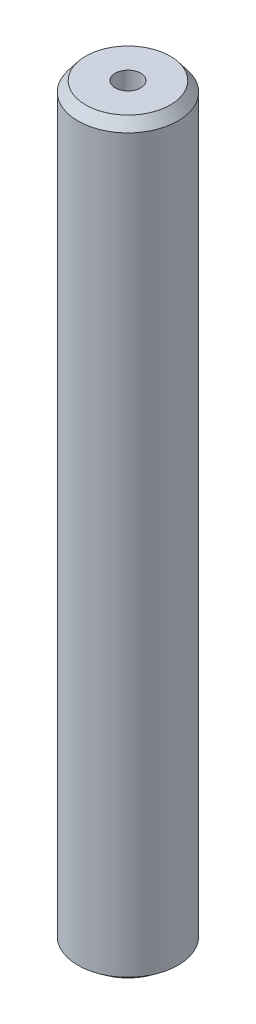
from build123d import *
from OCP.BRepFilletAPI import BRepFilletAPI_MakeChamfer

# Parameters (mm, degrees)
SKETCH1_R           = 5
BOSS_EXTRUDE1_DEPTH = 74.839464028
SKETCH2_R           = 1.274872446
CUT_EXTRUDE1_DEPTH  = 76.172770176
CHAMFER1_SIZE       = 0.999535333
CHAMFER1_SIZE2      = 0.771965313


with BuildPart() as part:
    # Sketch1 → Boss-Extrude1 (new body)
    with BuildSketch(Plane(origin=(0, 0, 0), x_dir=(1, 0, 0), z_dir=(0, 1, 0))):
        Circle(SKETCH1_R)
    extrude(amount=BOSS_EXTRUDE1_DEPTH)

    # Sketch2 → Cut-Extrude1 (cut, through all)
    with BuildSketch(Plane(origin=(0, 0, 0), x_dir=(1, 0, 0), z_dir=(0, 1, 0))):
        Circle(SKETCH2_R)
    extrude(amount=CUT_EXTRUDE1_DEPTH, mode=Mode.SUBTRACT)

    # Chamfer1: one chamfer whose edges measure the first distance from different faces: ONE call of the kernel's chamfer builder (chamfer() names one face for all edges)
    chamfer1_edges_1 = [part.edges().sort_by_distance(p)[0] for p in [
        (-5, 74.839464028, 0),
    ]]
    chamfer1_side_1 = [part.faces().sort_by_distance(p)[0] for p in [
        (-5, 37.419732014, 0),
    ]]
    chamfer1_edges_2 = [part.edges().sort_by_distance(p)[0] for p in [
        (-5, 0, 0),
    ]]
    chamfer1_side_2 = [part.faces().sort_by_distance(p)[0] for p in [
        (-4.858578644, 0, 0),
    ]]
    chamfer1 = BRepFilletAPI_MakeChamfer(part.part.solid().wrapped)
    for e in chamfer1_edges_1:
        chamfer1.Add(CHAMFER1_SIZE, CHAMFER1_SIZE2, e.wrapped, chamfer1_side_1[0].wrapped)  # the first distance lies on this face
    for e in chamfer1_edges_2:
        chamfer1.Add(CHAMFER1_SIZE, CHAMFER1_SIZE2, e.wrapped, chamfer1_side_2[0].wrapped)  # the first distance lies on this face
    add(Compound.cast(chamfer1.Shape()), mode=Mode.REPLACE)


solid = part.part
